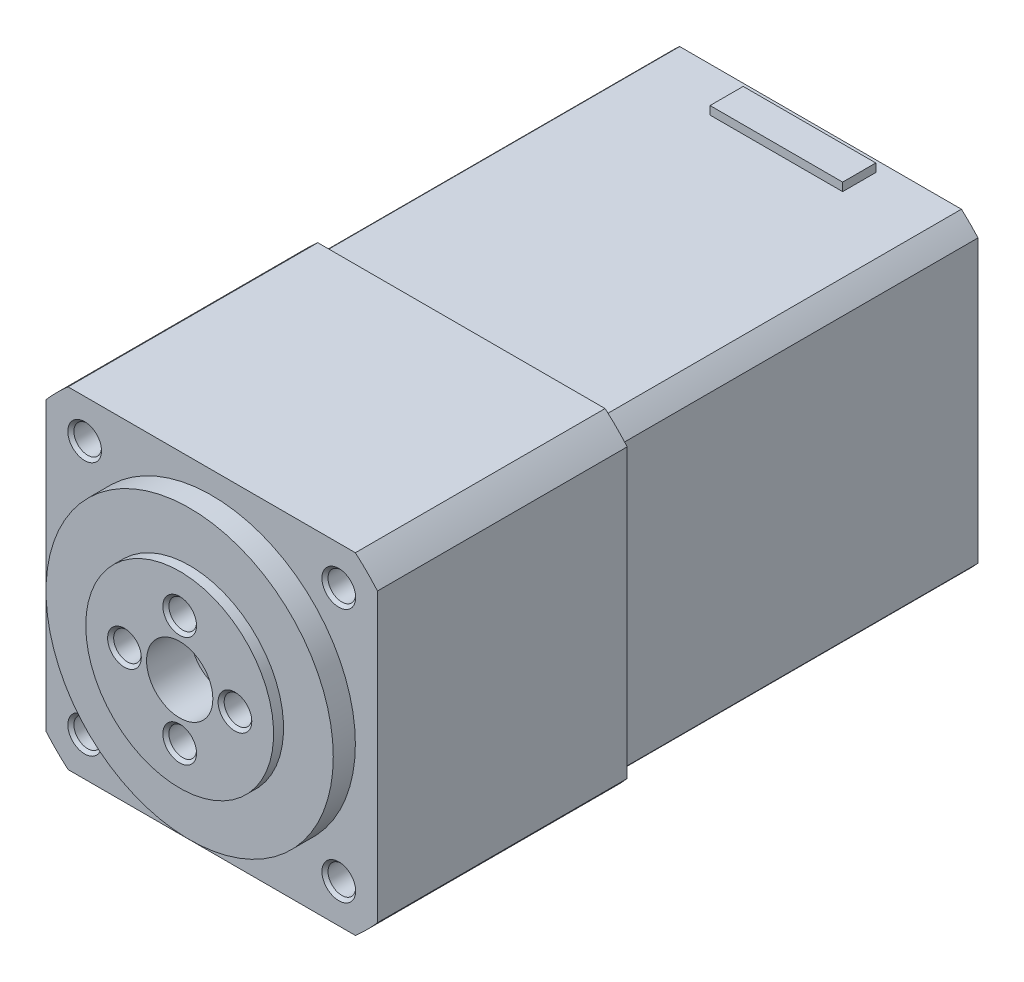
from build123d import *

# Parameters (mm, degrees)
SKETCH1_W           = 30
SKETCH1_H           = 30
BOSS_EXTRUDE1_DEPTH = 22.6
SKETCH3_W           = 28.5
SKETCH3_H           = 28.5
BOSS_EXTRUDE2_DEPTH = 32.5
SKETCH4_R           = 13
BOSS_EXTRUDE3_DEPTH = 2
SKETCH5_R           = 8.5
BOSS_EXTRUDE4_DEPTH = 0.9
SKETCH6_R           = 3
SKETCH6_R_2         = 1.25
CUT_EXTRUDE1_DEPTH  = 4
SKETCH10_R          = 1.25
CUT_EXTRUDE2_DEPTH  = 5
SKETCH12_R          = 3
CUT_EXTRUDE3_DEPTH  = 1
SKETCH13_R          = 29.849433241
SKETCH13_R_2        = 19.849433241
CUT_EXTRUDE4_DEPTH  = 22.6
SKETCH14_R          = 22.5
SKETCH14_R_2        = 19.121323176
CUT_EXTRUDE5_DEPTH  = 32.5
SKETCH15_R          = 4.5
CUT_EXTRUDE6_DEPTH  = 1
BOSS_EXTRUDE5_START = -1
SKETCH16_W          = 12
SKETCH16_H          = 0.75
BOSS_EXTRUDE5_DEPTH = 3


# Read off the part's stored shape, not the designer's step: M3x0.5 Tapped Hole1, M3x0.5 Tapped Hole2
with BuildPart() as part:
    # Sketch1 → Boss-Extrude1 (new body)
    with BuildSketch(Plane.XY):
        Rectangle(SKETCH1_W, SKETCH1_H)
    extrude(amount=BOSS_EXTRUDE1_DEPTH)

    # Sketch3 → Boss-Extrude2 (add)
    with BuildSketch(Plane(origin=(0, 0, 0), x_dir=(-1, 0, 0), z_dir=(0, 0, -1))):
        Rectangle(SKETCH3_W, SKETCH3_H)
    extrude(amount=BOSS_EXTRUDE2_DEPTH)

    # Sketch4 → Boss-Extrude3 (add)
    with BuildSketch(Plane.XY.offset(22.6)):
        Circle(SKETCH4_R)
    extrude(amount=BOSS_EXTRUDE3_DEPTH)

    # Sketch5 → Boss-Extrude4 (add)
    with BuildSketch(Plane.XY.offset(24.6)):
        with Locations(Location((0, 0, 0), (0, 0, 180))):
            Circle(SKETCH5_R)
    extrude(amount=BOSS_EXTRUDE4_DEPTH)

    # Sketch6 → Cut-Extrude1 (cut)
    with BuildSketch(Plane.XY.offset(25.5)):
        Circle(SKETCH6_R)
        with Locations((0, 5)):
            Circle(SKETCH6_R_2)
        with Locations((5, 0)):
            Circle(SKETCH6_R_2)
        with Locations((0, -5)):
            Circle(SKETCH6_R_2)
        with Locations((-5, 0)):
            Circle(SKETCH6_R_2)
    extrude(amount=-CUT_EXTRUDE1_DEPTH, mode=Mode.SUBTRACT)

    # M3x0.5 Tapped Hole1 outline → M3x0.5 Tapped Hole1 (revolve, cut)
    with BuildSketch(Plane(origin=(-5, 0, 0), x_dir=(1, 0, 0), z_dir=(0, -1, 0))):
        Polygon((1.25, 25.5), (1.25, 25.225), (1.525, 25.5), align=None)
    revolve(axis=Axis((-5, 0, 0), (0, 0, 1)), mode=Mode.SUBTRACT)

    # M3x0.5 Tapped Hole1 2 outline → M3x0.5 Tapped Hole1 2 (revolve, cut)
    with BuildSketch(Plane.XZ.offset(5)):
        Polygon((1.25, 25.5), (1.25, 25.225), (1.525, 25.5), align=None)
        Polygon((0, 20.748924226), (1.25, 21.5), (0, 21.5), align=None)
    revolve(axis=Axis((0, -5, 0), (0, 0, 1)), mode=Mode.SUBTRACT)

    # M3x0.5 Tapped Hole1 3 outline → M3x0.5 Tapped Hole1 3 (revolve, cut)
    with BuildSketch(Plane(origin=(5, 0, 0), x_dir=(1, 0, 0), z_dir=(0, -1, 0))):
        Polygon((1.25, 25.5), (1.25, 25.225), (1.525, 25.5), align=None)
        Polygon((0, 20.748924226), (1.25, 21.5), (0, 21.5), align=None)
    revolve(axis=Axis((5, 0, 0), (0, 0, 1)), mode=Mode.SUBTRACT)

    # M3x0.5 Tapped Hole1 4 outline → M3x0.5 Tapped Hole1 4 (revolve, cut)
    with BuildSketch(Plane.XZ.offset(-5)):
        Polygon((1.25, 25.5), (1.25, 25.225), (1.525, 25.5), align=None)
        Polygon((0, 20.748924226), (1.25, 21.5), (0, 21.5), align=None)
    revolve(axis=Axis((0, 5, 0), (0, 0, 1)), mode=Mode.SUBTRACT)

    # Sketch10 → Cut-Extrude2 (cut)
    with BuildSketch(Plane.XY.offset(22.6)):
        with Locations((-11.5, -11.5)):
            Circle(SKETCH10_R)
        with Locations((-11.5, 11.5)):
            Circle(SKETCH10_R)
        with Locations((11.5, 11.5)):
            Circle(SKETCH10_R)
        with Locations((11.5, -11.5)):
            Circle(SKETCH10_R)
    extrude(amount=-CUT_EXTRUDE2_DEPTH, mode=Mode.SUBTRACT)

    # M3x0.5 Tapped Hole2 outline → M3x0.5 Tapped Hole2 (revolve, cut)
    with BuildSketch(Plane(origin=(-11.5, -11.5, 0), x_dir=(1, 0, 0), z_dir=(0, -1, 0))):
        Polygon((1.25, 22.6), (1.25, 22.325), (1.525, 22.6), align=None)
    revolve(axis=Axis((-11.5, -11.5, 0), (0, 0, 1)), mode=Mode.SUBTRACT)

    # M3x0.5 Tapped Hole2 2 outline → M3x0.5 Tapped Hole2 2 (revolve, cut)
    with BuildSketch(Plane(origin=(11.5, -11.5, 0), x_dir=(1, 0, 0), z_dir=(0, -1, 0))):
        Polygon((1.25, 22.6), (1.25, 22.325), (1.525, 22.6), align=None)
        Polygon((0, 16.848924226), (1.25, 17.6), (0, 17.6), align=None)
    revolve(axis=Axis((11.5, -11.5, 0), (0, 0, 1)), mode=Mode.SUBTRACT)

    # M3x0.5 Tapped Hole2 3 outline → M3x0.5 Tapped Hole2 3 (revolve, cut)
    with BuildSketch(Plane(origin=(11.5, 11.5, 0), x_dir=(1, 0, 0), z_dir=(0, -1, 0))):
        Polygon((1.25, 22.6), (1.25, 22.325), (1.525, 22.6), align=None)
        Polygon((0, 16.848924226), (1.25, 17.6), (0, 17.6), align=None)
    revolve(axis=Axis((11.5, 11.5, 0), (0, 0, 1)), mode=Mode.SUBTRACT)

    # M3x0.5 Tapped Hole2 4 outline → M3x0.5 Tapped Hole2 4 (revolve, cut)
    with BuildSketch(Plane(origin=(-11.5, 11.5, 0), x_dir=(1, 0, 0), z_dir=(0, -1, 0))):
        Polygon((1.25, 22.6), (1.25, 22.325), (1.525, 22.6), align=None)
        Polygon((0, 16.848924226), (1.25, 17.6), (0, 17.6), align=None)
    revolve(axis=Axis((-11.5, 11.5, 0), (0, 0, 1)), mode=Mode.SUBTRACT)

    # Sketch12 → Cut-Extrude3 (cut)
    with BuildSketch(Plane.XZ.offset(15)):
        with Locations(Location((0, 4, 0), (0, 0, 270))):
            Circle(SKETCH12_R)
    extrude(amount=-CUT_EXTRUDE3_DEPTH, mode=Mode.SUBTRACT)

    # Sketch13 → Cut-Extrude4 (cut)
    with BuildSketch(Plane.XY.offset(22.6)):
        Circle(SKETCH13_R)
        Circle(SKETCH13_R_2, mode=Mode.SUBTRACT)
    extrude(amount=-CUT_EXTRUDE4_DEPTH, mode=Mode.SUBTRACT)

    # Sketch14 → Cut-Extrude5 (cut)
    with BuildSketch(Plane(origin=(0, 0, -32.5), x_dir=(-1, 0, 0), z_dir=(0, 0, -1))):
        Circle(SKETCH14_R)
        Circle(SKETCH14_R_2, mode=Mode.SUBTRACT)
    extrude(amount=-CUT_EXTRUDE5_DEPTH, mode=Mode.SUBTRACT)

    # Sketch15 → Cut-Extrude6 (cut)
    with BuildSketch(Plane(origin=(0, 0, -32.5), x_dir=(-1, 0, 0), z_dir=(0, 0, -1))):
        Circle(SKETCH15_R)
    extrude(amount=-CUT_EXTRUDE6_DEPTH, mode=Mode.SUBTRACT)

    # Sketch16 → Boss-Extrude5 (add)
    with BuildSketch(Plane(origin=(0, 0, -32.5), x_dir=(-1, 0, 0), z_dir=(0, 0, -1)).offset(BOSS_EXTRUDE5_START)):
        with Locations((0, 14.625)):
            Rectangle(SKETCH16_W, SKETCH16_H)
    extrude(amount=-BOSS_EXTRUDE5_DEPTH)


solid = part.part
